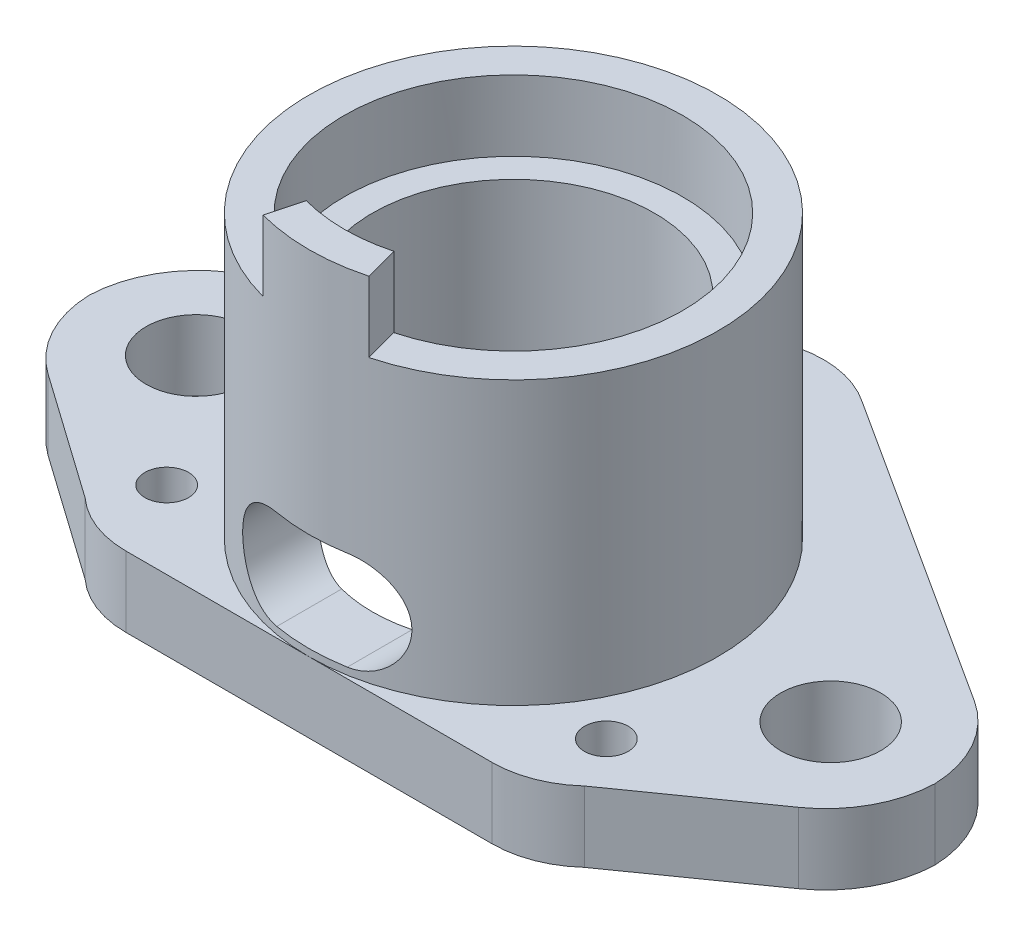
from build123d import *
from build123d.topology import SkipClean

# Parameters (mm, degrees)
SKETCH1_R           = 14.5
SKETCH1_R_2         = 10
BOSS_EXTRUDE1_DEPTH = 7.5
BOSS_EXTRUDE2_START = 5
SKETCH2_R           = 14.5
SKETCH2_R_2         = 12
BOSS_EXTRUDE2_DEPTH = 5
SKETCH3_R           = 12
SKETCH3_R_2         = 1.55
BOSS_EXTRUDE3_DEPTH = 5
FILLET1_R           = 7
BOSS_EXTRUDE4_START = 5
BOSS_EXTRUDE4_DEPTH = 5
CUT_EXTRUDE1_DEPTH  = 35.494425
EXTRUDE_START       = -5
SKETCH_1_R          = 3.55
SKETCH_1_R_2        = 1.55
EXTRUDE_1_DEPTH     = 5
FILLET_1_R          = 8


with BuildPart() as part:
    # Sketch1 → Boss-Extrude1 (new, symmetric)
    with BuildSketch(Plane(origin=(0, 0, 0), x_dir=(1, 0, 0), z_dir=(0, 1, 0))):
        with Locations(Location((0, 0, 0), (0, 0, 270))):
            Circle(SKETCH1_R)
        with Locations(Location((0, 0, 0), (0, 0, 270))):
            Circle(SKETCH1_R_2, mode=Mode.SUBTRACT)
    extrude(amount=BOSS_EXTRUDE1_DEPTH, both=True)

    # Sketch2 → Boss-Extrude2 (add)
    with BuildSketch(Plane(origin=(0, 7.5, 0), x_dir=(1, 0, 0), z_dir=(0, 1, 0)).offset(BOSS_EXTRUDE2_START)):
        with Locations(Location((0, 0, 0), (0, 0, 270))):
            Circle(SKETCH2_R)
        with Locations(Location((0, 0, 0), (0, 0, 270))):
            Circle(SKETCH2_R_2, mode=Mode.SUBTRACT)
    extrude(amount=-BOSS_EXTRUDE2_DEPTH)

    # Sketch3 → Boss-Extrude3 (add)
    with BuildSketch(Plane(origin=(0, -7.5, 0), x_dir=(-1, 0, 0), z_dir=(0, -1, 0))):
        Polygon((0, 29), (-25.114737, -14.5), (25.114737, -14.5), align=None)
        with Locations(Location((0, 0, 0), (0, 0, 270))):
            Circle(SKETCH3_R, mode=Mode.SUBTRACT)
        with Locations(Location((15.588457, -9, 0), (0, 0, 90))):
            Circle(SKETCH3_R_2, mode=Mode.SUBTRACT)
        with Locations(Location((-15.588457, -9, 0), (0, 0, 90))):
            Circle(SKETCH3_R_2, mode=Mode.SUBTRACT)
        with Locations(Location((0, 18, 0), (0, 0, 90))):
            Circle(SKETCH3_R_2, mode=Mode.SUBTRACT)
    extrude(amount=BOSS_EXTRUDE3_DEPTH)

    # Fillet1
    fillet1_edges = [part.edges().sort_by_distance(p)[0] for p in [
        (-25.114737, -10, 14.5),
        (0, -10, -29),
        (25.114737, -10, 14.5),
    ]]
    fillet(fillet1_edges, radius=FILLET1_R)

    # Sketch4 → Boss-Extrude4 (add)
    with SkipClean():  # the faces are left unmerged after this step: merging them gives an invalid solid
        with BuildSketch(Plane(origin=(0, 12.5, 0), x_dir=(1, 0, 0), z_dir=(0, 1, 0)).offset(BOSS_EXTRUDE4_START)):
            with BuildLine():
                Line((3.752876, -14.005924), (3.105829, -11.59111))
                ThreePointArc((3.105829, -11.59111), (0, -12), (-3.105829, -11.59111))
                Line((-3.105829, -11.59111), (-3.752876, -14.005924))
                ThreePointArc((-3.752876, -14.005924), (0, -14.5), (3.752876, -14.005924))
            make_face()
        extrude(amount=-BOSS_EXTRUDE4_DEPTH)

    # Sketch5 → Cut-Extrude1 (cut, through all)
    with SkipClean():  # the faces are left unmerged after this step: merging them gives an invalid solid
        with BuildSketch(Plane.XY):
            with BuildLine():
                Line((-2.5, 0), (2.5, 0))
                ThreePointArc((2.5, 0), (6, -3.5), (2.5, -7))
                Line((2.5, -7), (-2.5, -7))
                ThreePointArc((-2.5, -7), (-6, -3.5), (-2.5, 0))
            make_face()
        extrude(amount=CUT_EXTRUDE1_DEPTH, mode=Mode.SUBTRACT)

    # 草图1 → 凸台-拉伸1 (add)
    # profile 1 of 3: a face of its own
    with SkipClean():  # the faces are left unmerged after this step: merging them gives an invalid solid
        with BuildSketch(Plane(origin=(0, -7.5, 0), x_dir=(1, 0, 0), z_dir=(0, 1, 0)).offset(EXTRUDE_START)):
            with BuildLine():
                Line((-30, 4), (-30, -4))
                Line((-30, -4), (-17.703277, -12.675772))
                ThreePointArc((-17.703277, -12.675772), (-19.907231, -8.575729), (-19.052559, -4))
                Line((-19.052559, -4), (-12.557368, 7.25))
                Line((-12.557368, 7.25), (-6.062178, 18.5))
                ThreePointArc((-6.062178, 18.5), (-5.133957, 19.758412), (-3.949542, 20.77937))
                Line((-3.949542, 20.77937), (-30, 4))
            make_face()
            with Locations(Location((-22.5, 0, 0), (0, 0, 270))):
                Circle(SKETCH_1_R, mode=Mode.SUBTRACT)
        # profile 2 of 3: a face of its own
        with BuildSketch(Plane(origin=(0, -7.5, 0), x_dir=(1, 0, 0), z_dir=(0, 1, 0)).offset(EXTRUDE_START)):
            with BuildLine():
                Line((6.062178, 18.5), (12.557368, 7.25))
                Line((12.557368, 7.25), (19.052559, -4))
                ThreePointArc((19.052559, -4), (19.907231, -8.575729), (17.703277, -12.675772))
                Line((17.703277, -12.675772), (30, -4))
                Line((30, -4), (30, 4))
                Line((30, 4), (3.949542, 20.77937))
                ThreePointArc((3.949542, 20.77937), (5.133957, 19.758412), (6.062178, 18.5))
            make_face()
            with Locations(Location((22.5, 0, 0), (0, 0, 270))):
                Circle(SKETCH_1_R, mode=Mode.SUBTRACT)
        # profile 3 of 3: a face of its own
        with BuildSketch(Plane(origin=(0, -7.5, 0), x_dir=(1, 0, 0), z_dir=(0, 1, 0)).offset(EXTRUDE_START)):
            with BuildLine():
                ThreePointArc((0, -14.5), (-12.557368, -7.25), (-12.557368, 7.25))
                Line((-12.557368, 7.25), (-19.052559, -4))
                ThreePointArc((-19.052559, -4), (-19.052559, -11), (-12.990381, -14.5))
                Line((-12.990381, -14.5), (0, -14.5))
            make_face()
            with Locations(Location((-15.588457, -9, 0), (0, 0, 90))):
                Circle(SKETCH_1_R_2, mode=Mode.SUBTRACT)
        extrude(amount=EXTRUDE_1_DEPTH)

    # 圆角1
    # the kernel refuses this fillet: 8 mm, written as the material it takes off along each edge
    with BuildSketch(Plane(origin=(30, -23.407523, -4), x_dir=(-0.8406988978584584, 0, -0.5415028745441463), z_dir=(0, 1, 0)), Plane(origin=(-30, -23.407523, -4), x_dir=(0, 0, 1), z_dir=(0, 1, 0))) as fillet_1_piece_1:
        with BuildLine():
            CenterArc((FILLET_1_R * 0.545376146708, FILLET_1_R), FILLET_1_R, 212.786005, 57.213995)
            Line((-FILLET_1_R * 0.29532275115, FILLET_1_R * 0.458497125456), (0, 0))
            Line((0, 0), (FILLET_1_R * 0.545376146708, 0))
        make_face()
    extrude(amount=26.815046, mode=Mode.SUBTRACT)
    with BuildSketch(Plane(origin=(30, -22.866059, 4), x_dir=(-0.8171014589275256, 0, 0.5764938905300812), z_dir=(0, 1, 0))) as fillet_1_piece_2:
        with BuildLine():
            CenterArc((FILLET_1_R * 0.518302965737, -FILLET_1_R), FILLET_1_R, 90, 54.795682)
            Line((-FILLET_1_R * 0.298798493191, -FILLET_1_R * 0.42350610947), (0, 0))
            Line((0, 0), (FILLET_1_R * 0.518302965737, 0))
        make_face()
    extrude(amount=25.732119, mode=Mode.SUBTRACT)
    with BuildSketch(Plane(origin=(-30, -22.866059, 4), x_dir=(0.8171014589275294, 0, 0.5764938905300758), z_dir=(0, 1, 0))) as fillet_1_piece_3:
        with BuildLine():
            CenterArc((FILLET_1_R * 0.518302965737, FILLET_1_R), FILLET_1_R, 215.204318, 54.795682)
            Line((-FILLET_1_R * 0.298798493191, FILLET_1_R * 0.42350610947), (0, 0))
            Line((0, 0), (FILLET_1_R * 0.518302965737, 0))
        make_face()
    extrude(amount=25.732119, mode=Mode.SUBTRACT)


solid = part.part
